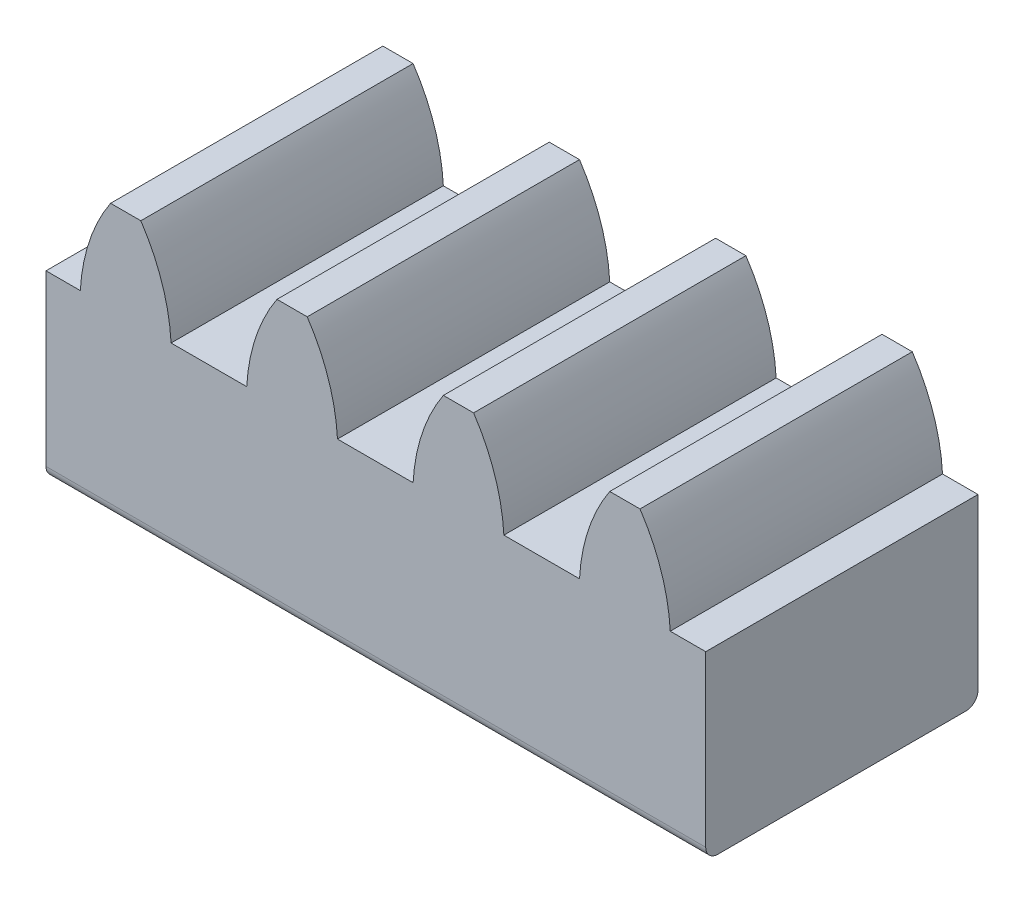
from build123d import *

# Parameters (mm, degrees)
SKETCH1_W                 = 230
SKETCH1_H                 = 6
BOSS_EXTRUDE1_DEPTH       = 9
BOSS_EXTRUDE2_DEPTH       = 9
LPATTERN1_COUNT           = 41
LPATTERN1_PITCH           = 5.5
SKETCH2_W                 = 15
SKETCH2_H                 = 20
BOSS_EXTRUDE3_DEPTH       = 5
FILLET1_R                 = 10
FILLET2_R                 = 3
SKETCH3_W                 = 13
SKETCH3_H                 = 8
BOSS_EXTRUDE4_DEPTH       = 5
SKETCH4_W                 = 3
SKETCH4_H                 = 8
BOSS_EXTRUDE5_DEPTH       = 5
FILLET3_R                 = 0.4
F_3_0MM_DOWEL_HOLE1_D     = 2.7
F_3_0MM_DOWEL_HOLE1_DEPTH = 7
F_3_0MM_DOWEL_HOLE1_TIP   = 0.811161836
SKETCH6_W                 = 22.006931309
SKETCH6_H                 = 16.378230192
SKETCH6_W_2               = 21.806931309
SKETCH6_H_2               = 16.178230192
CUT_EXTRUDE1_DEPTH        = 180.611613715


with BuildPart() as part:
    # Sketch1 → Boss-Extrude1 (new body)
    with BuildSketch(Plane.XY):
        with Locations((54.307342656, -37.82930415)):
            Rectangle(SKETCH1_W, SKETCH1_H)
    extrude(amount=-BOSS_EXTRUDE1_DEPTH)

    # Sketch1<3> → Boss-Extrude2 (add)
    with BuildSketch(Plane.XY):
        with BuildLine():
            ThreePointArc((-56.340727793, -31.82930415), (-57.041926016, -33.262238075), (-57.340727793, -34.82930415))
            Line((-57.340727793, -34.82930415), (-54.340727793, -34.82930415))
            ThreePointArc((-54.340727793, -34.82930415), (-54.63952957, -33.262238075), (-55.340727793, -31.82930415))
            Line((-55.340727793, -31.82930415), (-56.340727793, -31.82930415))
        make_face()
    boss_extrude2 = extrude(amount=-BOSS_EXTRUDE2_DEPTH)

    # LPattern1: Boss-Extrude2 ×41
    with Locations(*[(i * LPATTERN1_PITCH, 0, 0) for i in range(1, LPATTERN1_COUNT)]):
        add(boss_extrude2)

    # Sketch2 → Boss-Extrude3 (add)
    with BuildSketch(Plane.XZ.offset(40.82930415)):
        with Locations((-68.192657344, -4.5)):
            Rectangle(SKETCH2_W, SKETCH2_H)
    extrude(amount=-BOSS_EXTRUDE3_DEPTH)

    # Fillet1
    # the kernel refuses this fillet: 10 mm, written as the material it adds along each edge
    with BuildSketch(Plane(origin=(-60.692657344, -35.82930415, 0), x_dir=(0, 1, 0), z_dir=(0, 0, -1))) as fillet1_piece_1:
        with BuildLine():
            CenterArc((10, -4.358898944), FILLET1_R, 154.158067237, 25.841932763)
            Line((0, -4.358898944), (0, 0))
            Line((0, 0), (1, 0))
        make_face()
    extrude(amount=9)

    # Fillet2
    fillet2_edges = [part.edges().sort_by_distance(p)[0] for p in [
        (-60.692657344, -38.32930415, 5.5),
        (-60.692657344, -38.32930415, -14.5),
        (-75.692657344, -38.32930415, -14.5),
        (-75.692657344, -38.32930415, 5.5),
    ]]
    fillet(fillet2_edges, radius=FILLET2_R)

    # Sketch3 → Boss-Extrude4 (add)
    with BuildSketch(Plane(origin=(169.307342656, 0, 0), x_dir=(0, 0, -1), z_dir=(1, 0, 0))):
        with Locations((4.5, -36.82930415)):
            Rectangle(SKETCH3_W, SKETCH3_H)
    extrude(amount=BOSS_EXTRUDE4_DEPTH)

    # Sketch4 → Boss-Extrude5 (add)
    with BuildSketch(Plane.XY.offset(2)):
        with Locations((170.807342656, -36.82930415)):
            Rectangle(SKETCH4_W, SKETCH4_H)
    extrude(amount=BOSS_EXTRUDE5_DEPTH)

    # Fillet3
    fillet3_edges = [part.edges().sort_by_distance(p)[0] for p in [
        (54.307342656, -40.82930415, -9),
        (-60.692657344, -40.82930415, 1.25),
        (-68.192657344, -40.82930415, -14.5),
        (-68.192657344, -40.82930415, 5.5),
        (-75.692657344, -40.82930415, -4.5),
        (-60.692657344, -40.82930415, -10.25),
        (-61.571337, -40.82930415, 4.621320344),
        (-74.813977688, -40.82930415, 4.621320344),
        (-74.813977688, -40.82930415, -13.621320344),
        (-61.571337, -40.82930415, -13.621320344),
        (173.307342656, -32.82930415, 2),
        (169.307342656, -40.82930415, 3.5),
        (169.307342656, -40.82930415, -10),
        (173.307342656, -40.82930415, 2),
        (171.807342656, -40.82930415, -11),
        (169.307342656, -32.82930415, -2),
        (171.807342656, -32.82930415, -11),
        (174.307342656, -36.82930415, 2),
        (174.307342656, -40.82930415, -4.5),
        (174.307342656, -36.82930415, -11),
        (174.307342656, -32.82930415, -4.5),
        (172.307342656, -36.82930415, 2),
        (172.307342656, -40.82930415, 4.5),
        (172.307342656, -32.82930415, 4.5),
        (169.307342656, -36.82930415, 7),
        (170.807342656, -40.82930415, 7),
        (172.307342656, -36.82930415, 7),
        (170.807342656, -32.82930415, 7),
        (54.307342656, -40.82930415, 0),
    ]]
    fillet(fillet3_edges, radius=FILLET3_R)

    # Ø3.0mm Dowel Hole1
    with Locations(Plane(origin=(-65.692657344, -40.82930415, 1.5), x_dir=(0, 0, -1), z_dir=(0, -1, 0))):
        with Locations((0, 0), (12, 0), (5.991996797, -6)):
            Hole(F_3_0MM_DOWEL_HOLE1_D / 2, depth=F_3_0MM_DOWEL_HOLE1_DEPTH)
            with Locations((0, 0, -(F_3_0MM_DOWEL_HOLE1_DEPTH + F_3_0MM_DOWEL_HOLE1_TIP / 2))):  # 118° drill point
                Cone(0, F_3_0MM_DOWEL_HOLE1_D / 2, F_3_0MM_DOWEL_HOLE1_TIP, mode=Mode.SUBTRACT)

    # Sketch6 → Cut-Extrude1 (cut, through all)
    with BuildSketch(Plane.XY):
        with Locations((-47.571737998, -32.740189054)):
            Rectangle(SKETCH6_W, SKETCH6_H)
        with Locations((-47.571737998, -32.740189054)):
            Rectangle(SKETCH6_W_2, SKETCH6_H_2, mode=Mode.SUBTRACT)
    extrude(amount=-CUT_EXTRUDE1_DEPTH, mode=Mode.SUBTRACT)


with BuildPart() as cut_extrude1_piece_1:
    # of the separate pieces the step leaves, piece 1, a body of its own (cut_extrude1_pieces)
    add(part.part.solids().sort_by_distance((-36.568272343, -40.82930415, -8.6))[0])


with BuildPart() as cut_extrude1_piece_2:
    # of the separate pieces the step leaves, piece 2, a body of its own (cut_extrude1_pieces)
    add(part.part.solids().sort_by_distance((-58.575203652, -40.82930415, -0.4))[0])


with BuildPart() as cut_extrude1_piece_3:
    # of the separate pieces the step leaves, piece 3, a body of its own (cut_extrude1_pieces)
    add(part.part.solids().sort_by_distance((-58.475203652, -40.82930415, -8.6))[0])


solid = cut_extrude1_piece_3.part
